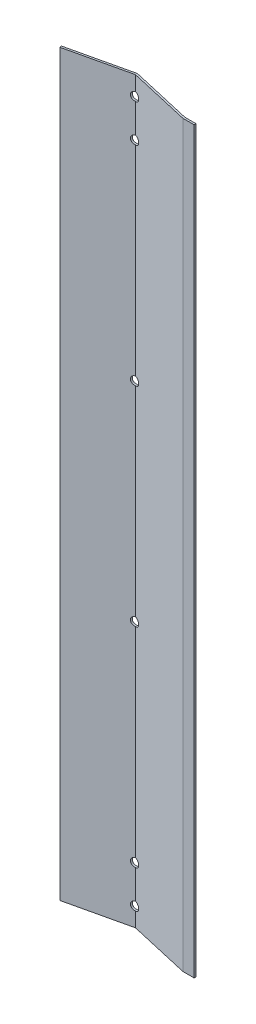
from build123d import *

# Parameters (mm, degrees)
BOSS_EXTRUDE1_DEPTH     = 1960
CUT_EXTRUDE1_DEPTH      = 2364.679000852
CUT_EXTRUDE1_DEPTH_BACK = 2364.679000852
SKETCH2_R               = 11


with BuildPart() as part:
    # Sketch1 → Boss-Extrude1 (new body)
    with BuildSketch(Plane(origin=(0, 0, 0), x_dir=(1, 0, 0), z_dir=(0, 1, 0))):
        Polygon((-506.627585227, -999.704780497), (-536.627585227, -999.704780497), (-699.627585227, -962.343755534), (-862.627585227, -999.704780497), (-863.694836689, -994.820010869), (-699.627585227, -957.225806909), (-536.087738826, -994.704780497), (-506.627585227, -994.704780497), align=None)
    extrude(amount=BOSS_EXTRUDE1_DEPTH)

    # Sketch2 → Cut-Extrude1 (cut, two sides: drawn at the far end of the back side and taken through both)
    with BuildSketch(Plane.XY.offset(-CUT_EXTRUDE1_DEPTH_BACK)):
        with Locations((-699.627585227, 50)):
            Circle(SKETCH2_R)
        with Locations((-699.627585227, 150)):
            Circle(SKETCH2_R)
        with Locations((-699.627585227, 1910)):
            Circle(SKETCH2_R)
        with Locations((-699.627585227, 1810)):
            Circle(SKETCH2_R)
        with Locations((-699.627585227, 703.33)):
            Circle(SKETCH2_R)
        with Locations((-699.627585227, 1256.66)):
            Circle(SKETCH2_R)
    extrude(amount=CUT_EXTRUDE1_DEPTH + CUT_EXTRUDE1_DEPTH_BACK, mode=Mode.SUBTRACT)


solid = part.part
